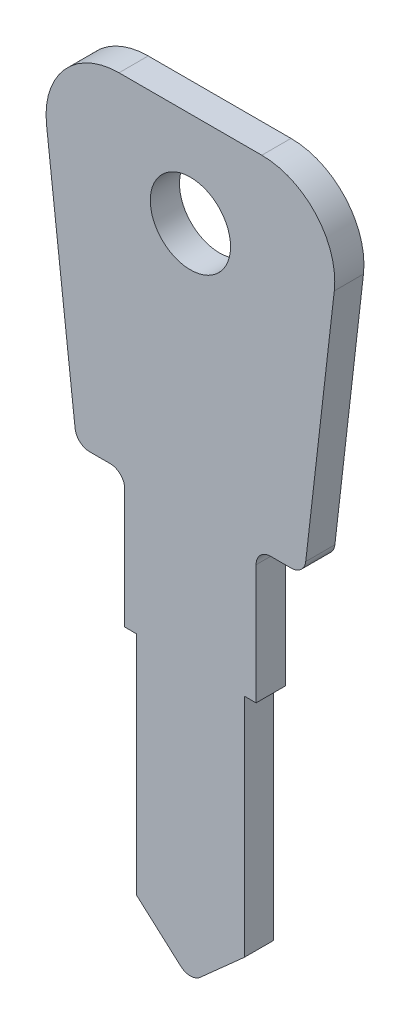
from build123d import *

# Parameters (mm, degrees)
EXTRUDE_1_DEPTH      = 1
EXTRUDE_1_DEPTH_BACK = 1
FILLET_1_R           = 1
SKETCH_2_R           = 2.75
CUT_EXTRUDE_1_DEPTH  = 2


with BuildPart() as part:
    # 草图1 → 凸台-拉伸1 (new, two sides: drawn at the far end of the back side and taken through both)
    with BuildSketch(Plane.XY.offset(-EXTRUDE_1_DEPTH_BACK)):
        with BuildLine():
            Line((-7.901779348, 0.885857286), (-9.859960569, 17.92928643))
            ThreePointArc((-9.859960569, 17.92928643), (-8.624499405, 21.827644223), (-4.892638753, 23.5))
            Line((-4.892638753, 23.5), (4.892638753, 23.5))
            ThreePointArc((4.892638753, 23.5), (8.624499405, 21.827644223), (9.859960569, 17.92928643))
            Line((9.859960569, 17.92928643), (7.901779348, 0.885857286))
            ThreePointArc((7.901779348, 0.885857286), (7.573843829, 0.25362787), (6.908314985, 0))
            Line((6.908314985, 0), (5.5, 0))
            ThreePointArc((5.5, 0), (4.792893219, -0.292893219), (4.5, -1))
            Line((4.5, -1), (4.5, -9.2))
            Line((4.5, -9.2), (3.7, -9.2))
            Line((3.7, -9.2), (3.7, -24.7))
            Line((3.7, -24.7), (0, -28))
            Line((0, -28), (-3.7, -24.7))
            Line((-3.7, -24.7), (-3.7, -9.2))
            Line((-3.7, -9.2), (-4.5, -9.2))
            Line((-4.5, -9.2), (-4.5, -1))
            ThreePointArc((-4.5, -1), (-4.792893219, -0.292893219), (-5.5, 0))
            Line((-5.5, 0), (-6.908314985, 0))
            ThreePointArc((-6.908314985, 0), (-7.573843829, 0.25362787), (-7.901779348, 0.885857286))
        make_face()
    extrude(amount=EXTRUDE_1_DEPTH + EXTRUDE_1_DEPTH_BACK)

    # 圆角1
    fillet_1_edges = [part.edges().sort_by_distance(p)[0] for p in [
        (0, -28, 0),
    ]]
    fillet(fillet_1_edges, radius=FILLET_1_R)

    # 草图2 → 切除-拉伸1 (cut)
    with BuildSketch(Plane.XY.offset(1)):
        with Locations((0, 17)):
            Circle(SKETCH_2_R)
    extrude(amount=-CUT_EXTRUDE_1_DEPTH, mode=Mode.SUBTRACT)


solid = part.part
